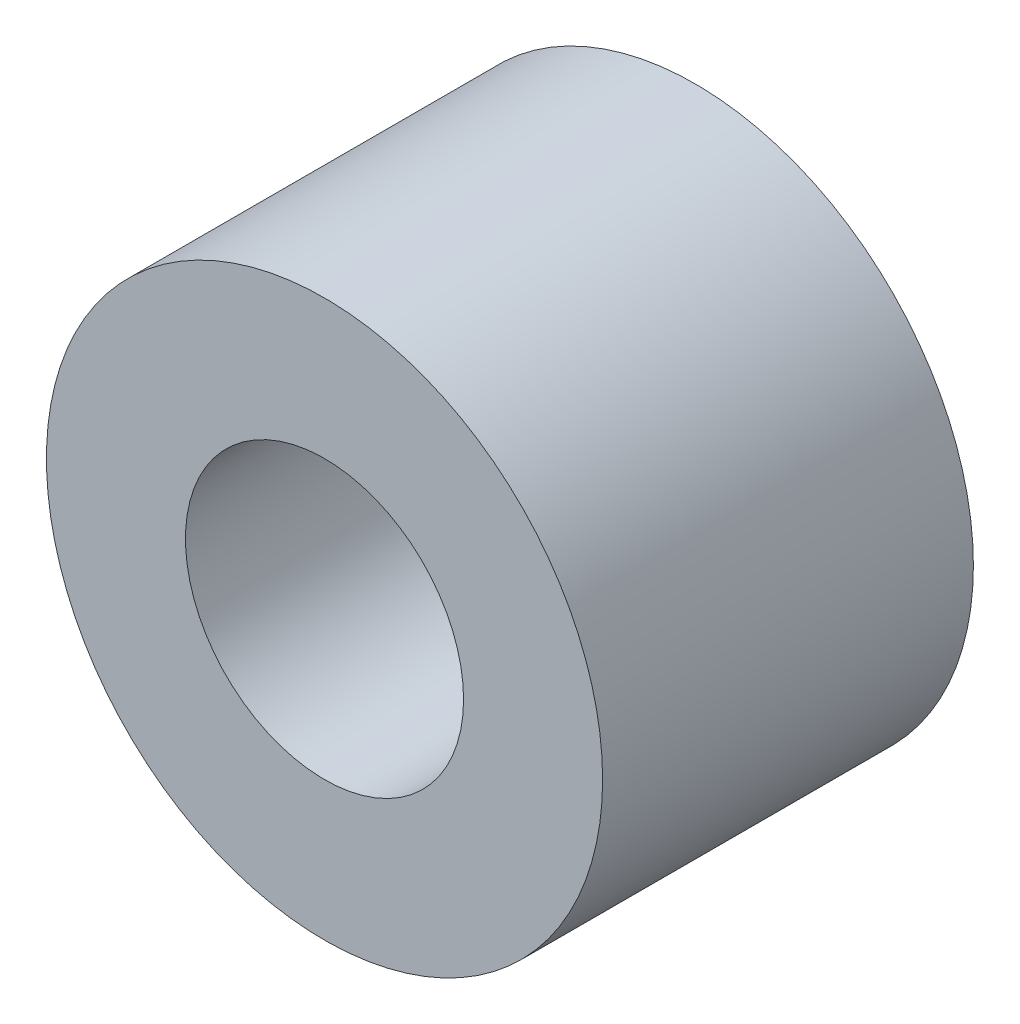
from build123d import *

# Parameters (mm, degrees)
SKETCH1_R           = 3.000000063
SKETCH1_R_2         = 1.500000076
BOSS_EXTRUDE2_DEPTH = 4


# Read off the part's stored shape, not the designer's step: Imported1
with BuildPart() as part:
    # Sketch1 → Boss-Extrude2 (new body)
    with BuildSketch(Plane.XY.offset(4.00000019)):
        with Locations((3.000000013, 3.000000141)):
            Circle(SKETCH1_R)
        with Locations((3.000000156, 3.000000094)):
            Circle(SKETCH1_R_2, mode=Mode.SUBTRACT)
    extrude(amount=BOSS_EXTRUDE2_DEPTH)


solid = part.part
